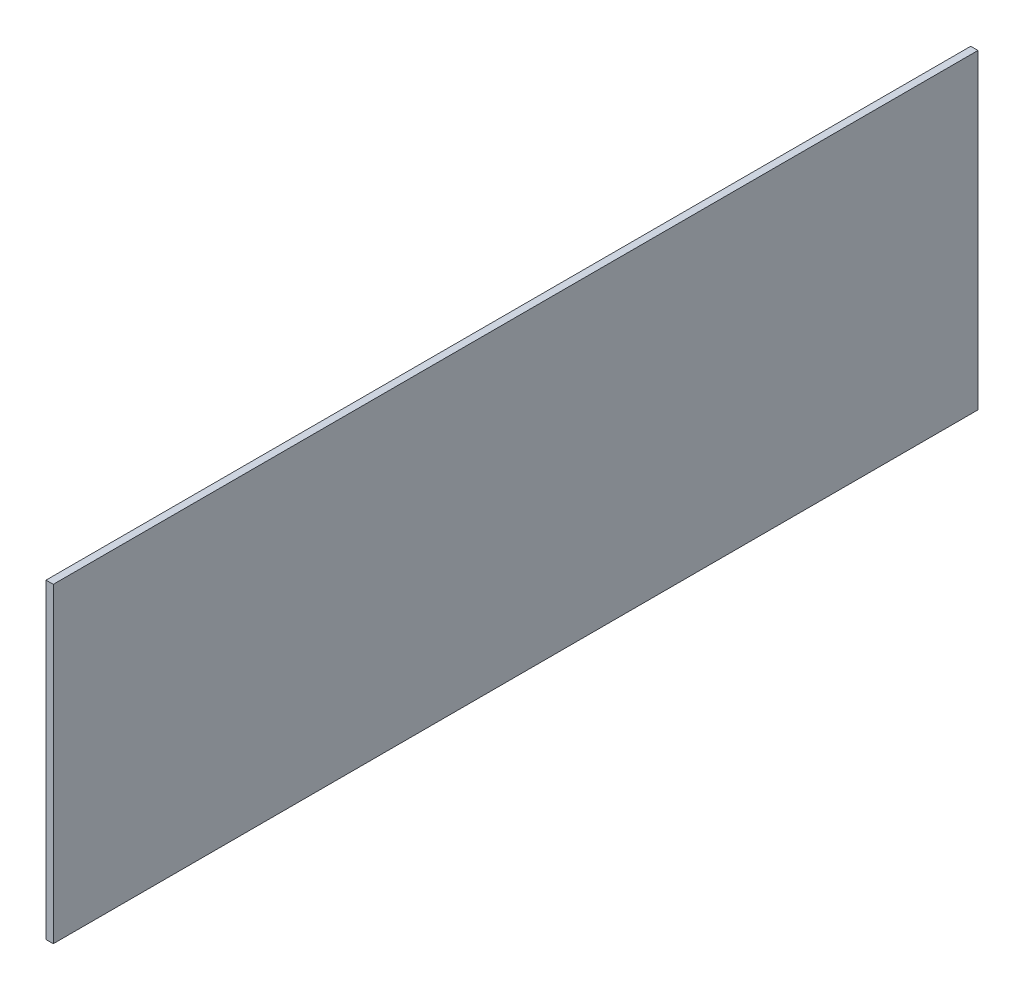
from build123d import *

# Parameters (mm, degrees)
SKETCH1_W           = 3
SKETCH1_H           = 128.333333333
BOSS_EXTRUDE1_DEPTH = 381.25


with BuildPart() as part:
    # Sketch1 → Boss-Extrude1 (new body)
    with BuildSketch(Plane.XY):
        with Locations((-82.833333333, 432.833333334)):
            Rectangle(SKETCH1_W, SKETCH1_H)
    extrude(amount=BOSS_EXTRUDE1_DEPTH)


solid = part.part
